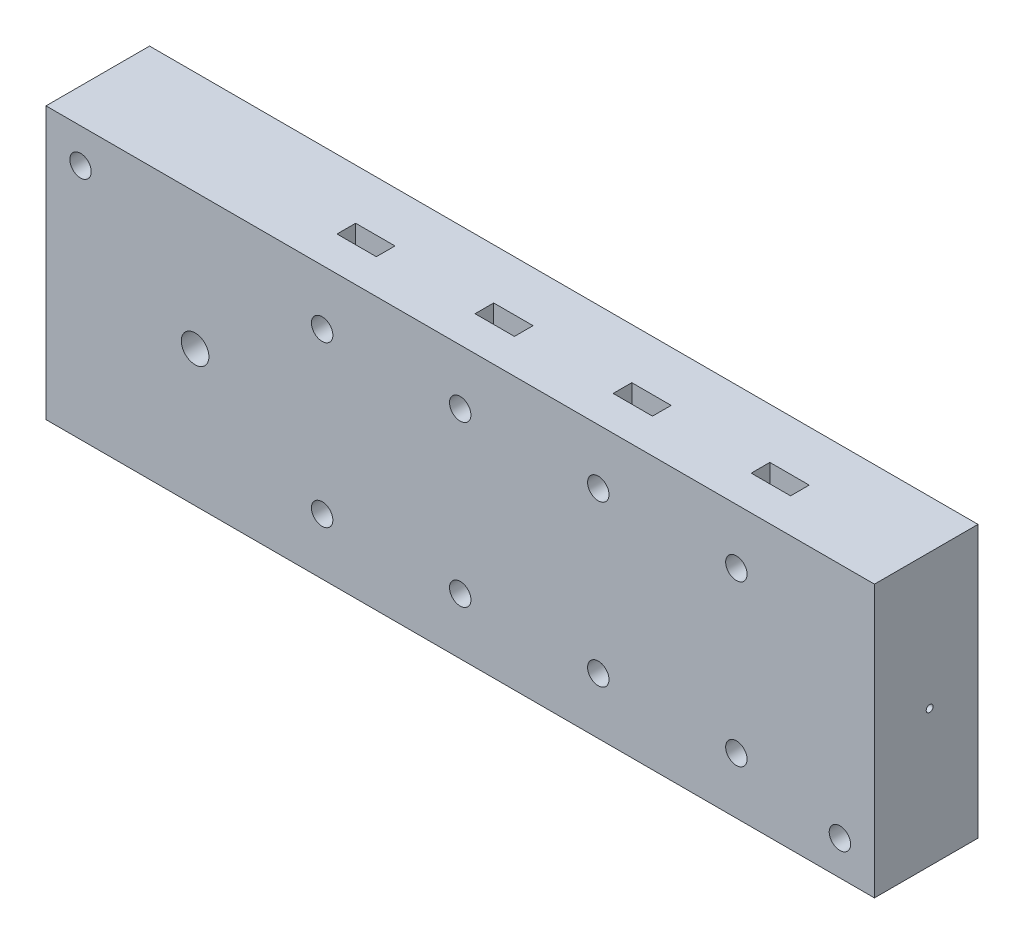
from build123d import *

# Parameters (mm, degrees)
SKIZZE2_W                        = 120
SKIZZE2_H                        = 39.364160046
AUFSATZ_LINEAR_AUSTRAGEN1_DEPTH  = 30
SKIZZE24_R                       = 1.55
SCHNITT_LINEAR_AUSTRAGEN4_DEPTH  = 130.805766806
SKIZZE46_R                       = 2.85
SCHNITT_LINEAR_AUSTRAGEN15_DEPTH = 10
SCHNITT_LINEAR_START             = -5
SCHNITT_LINEAR_AUSTRAGEN25_DEPTH = 2.7
LINEARES_MUSTER1_COUNT           = 4
LINEARES_MUSTER1_PITCH           = 20
SPIEGELN2_COPY_1_SKETCH_R        = 2.85
SPIEGELN2_COPY_1_DEPTH           = 10
SPIEGELN2_COPY_2_SKETCH_R        = 2.85
SPIEGELN2_COPY_2_DEPTH           = 10
SPIEGELN2_COPY_3_SKETCH_R        = 2.85
SPIEGELN2_COPY_3_DEPTH           = 10
SPIEGELN2_START                  = -5
SPIEGELN2_COPY_4_DEPTH           = 2.7
SPIEGELN2_COPY_5_DEPTH           = 2.7
SPIEGELN2_COPY_6_DEPTH           = 2.7
SKIZZE51_R                       = 1.55
SCHNITT_LINEAR_AUSTRAGEN26_DEPTH = 130.805766806
SKIZZE75_R                       = 0.75
SCHNITT_LINEAR_AUSTRAGEN28_DEPTH = 10
SKIZZE76_R                       = 2
SCHNITT_LINEAR_AUSTRAGEN29_DEPTH = 6
SKIZZE80_R                       = 0.5
SCHNITT_LINEAR_AUSTRAGEN34_DEPTH = 21
SCHNITT_LINEAR_START_2           = -7.5
SKIZZE81_R                       = 0.5
SCHNITT_LINEAR_AUSTRAGEN36_DEPTH = 5
ABSPALTEN3_OUTLINE_W             = 120
ABSPALTEN3_OUTLINE_H             = 39.364160046
ABSPALTEN3_OUTLINE_R             = 1.55
ABSPALTEN3_DEPTH                 = 15


# Read off the part's stored shape, not the designer's step: Abspalten3
with BuildPart() as part:
    # Skizze2 → Aufsatz-Linear austragen1 (new body)
    with BuildSketch(Plane.XY):
        with Locations((60, 19.682080023)):
            Rectangle(SKIZZE2_W, SKIZZE2_H)
    extrude(amount=AUFSATZ_LINEAR_AUSTRAGEN1_DEPTH)

    # Skizze24 → Schnitt-Linear austragen4 (cut, through all)
    with BuildSketch(Plane.XY.offset(30)):
        with Locations((40, 31.364160046)):
            Circle(SKIZZE24_R)
        with Locations((60, 31.364160046)):
            Circle(SKIZZE24_R)
        with Locations((80, 31.364160046)):
            Circle(SKIZZE24_R)
        with Locations((100, 31.364160046)):
            Circle(SKIZZE24_R)
    schnitt_linear_austragen4 = extrude(amount=-SCHNITT_LINEAR_AUSTRAGEN4_DEPTH, mode=Mode.SUBTRACT)

    # Skizze46 → Schnitt-Linear austragen15 (cut)
    with BuildSketch(Plane(origin=(0, 0, 0), x_dir=(-1, 0, 0), z_dir=(0, 0, -1))):
        with Locations((-100, 31.364160046)):
            Circle(SKIZZE46_R)
    schnitt_linear_austragen15 = extrude(amount=-SCHNITT_LINEAR_AUSTRAGEN15_DEPTH, mode=Mode.SUBTRACT)

    # Skizze50 → Schnitt-Linear austragen25 (cut)
    with BuildSketch(Plane.XY.offset(30).offset(SCHNITT_LINEAR_START)):
        Polygon((97.15, 33.009608314), (97.15, 39.364160046), (102.85, 39.364160046), (102.85, 33.009608314), (102.85, 29.718711779), (100, 28.073263512), (97.15, 29.718711779), align=None)
    schnitt_linear_austragen25 = extrude(amount=-SCHNITT_LINEAR_AUSTRAGEN25_DEPTH, mode=Mode.SUBTRACT)

    # Lineares Muster1: Schnitt-Linear austragen15, Schnitt-Linear austragen25 ×4
    with Locations(*[(-i * LINEARES_MUSTER1_PITCH, 0, 0) for i in range(1, LINEARES_MUSTER1_COUNT)]):
        add(schnitt_linear_austragen15, mode=Mode.SUBTRACT)
        add(schnitt_linear_austragen25, mode=Mode.SUBTRACT)

    # Spiegeln2: Schnitt-Linear austragen15, Schnitt-Linear austragen25 across plane
    add(schnitt_linear_austragen15.mirror(Plane.ZX.offset(19.764160046)), mode=Mode.SUBTRACT)
    add(schnitt_linear_austragen25.mirror(Plane.ZX.offset(19.764160046)), mode=Mode.SUBTRACT)

    # Spiegeln2 copy 1 sketch → Spiegeln2 copy 1 (cut)
    with BuildSketch(Plane(origin=(-20, 39.528320093, 0), x_dir=(-1, 0, 0), z_dir=(0, 0, -1))):
        with Locations((-100, -31.364160046)):
            Circle(SPIEGELN2_COPY_1_SKETCH_R)
    extrude(amount=-SPIEGELN2_COPY_1_DEPTH, mode=Mode.SUBTRACT)

    # Spiegeln2 copy 2 sketch → Spiegeln2 copy 2 (cut)
    with BuildSketch(Plane(origin=(-40, 39.528320093, 0), x_dir=(-1, 0, 0), z_dir=(0, 0, -1))):
        with Locations((-100, -31.364160046)):
            Circle(SPIEGELN2_COPY_2_SKETCH_R)
    extrude(amount=-SPIEGELN2_COPY_2_DEPTH, mode=Mode.SUBTRACT)

    # Spiegeln2 copy 3 sketch → Spiegeln2 copy 3 (cut)
    with BuildSketch(Plane(origin=(-60, 39.528320093, 0), x_dir=(-1, 0, 0), z_dir=(0, 0, -1))):
        with Locations((-100, -31.364160046)):
            Circle(SPIEGELN2_COPY_3_SKETCH_R)
    extrude(amount=-SPIEGELN2_COPY_3_DEPTH, mode=Mode.SUBTRACT)

    # Spiegeln2 copy 4 sketch → Spiegeln2 copy 4 (cut)
    with BuildSketch(Plane(origin=(-20, 39.528320093, 30), x_dir=(1, 0, 0), z_dir=(0, 0, 1)).offset(SPIEGELN2_START)):
        Polygon((97.15, -33.009608314), (97.15, -39.364160046), (102.85, -39.364160046), (102.85, -33.009608314), (102.85, -29.718711779), (100, -28.073263512), (97.15, -29.718711779), align=None)
    extrude(amount=-SPIEGELN2_COPY_4_DEPTH, mode=Mode.SUBTRACT)

    # Spiegeln2 copy 5 sketch → Spiegeln2 copy 5 (cut)
    with BuildSketch(Plane(origin=(-40, 39.528320093, 30), x_dir=(1, 0, 0), z_dir=(0, 0, 1)).offset(SPIEGELN2_START)):
        Polygon((97.15, -33.009608314), (97.15, -39.364160046), (102.85, -39.364160046), (102.85, -33.009608314), (102.85, -29.718711779), (100, -28.073263512), (97.15, -29.718711779), align=None)
    extrude(amount=-SPIEGELN2_COPY_5_DEPTH, mode=Mode.SUBTRACT)

    # Spiegeln2 copy 6 sketch → Spiegeln2 copy 6 (cut)
    with BuildSketch(Plane(origin=(-60, 39.528320093, 30), x_dir=(1, 0, 0), z_dir=(0, 0, 1)).offset(SPIEGELN2_START)):
        Polygon((97.15, -33.009608314), (97.15, -39.364160046), (102.85, -39.364160046), (102.85, -33.009608314), (102.85, -29.718711779), (100, -28.073263512), (97.15, -29.718711779), align=None)
    extrude(amount=-SPIEGELN2_COPY_6_DEPTH, mode=Mode.SUBTRACT)

    # Spiegeln3: Schnitt-Linear austragen4 across plane
    add(schnitt_linear_austragen4.mirror(Plane.ZX.offset(19.764160046)), mode=Mode.SUBTRACT)

    # Skizze51 → Schnitt-Linear austragen26 (cut, through all)
    with BuildSketch(Plane.XY.offset(30)):
        with Locations((5, 34.364160046)):
            Circle(SKIZZE51_R)
        with Locations((115, 5)):
            Circle(SKIZZE51_R)
    extrude(amount=-SCHNITT_LINEAR_AUSTRAGEN26_DEPTH, mode=Mode.SUBTRACT)

    # Skizze73 → Schnitt-Rotation5 (revolve, cut)
    with BuildSketch(Plane.XY.offset(15)):
        Polygon((15, 19.764160046), (15, 23.764160046), (20, 23.764160046), (20, 24.764160046), (100, 23.182080023), (100, 22.182080023), (105, 22.182080023), (105, 19.682080023), align=None)
    revolve(axis=Axis((105, 19.682080023, 15), (-0.9999995841280241, 0.0009119998787298228, 0)), mode=Mode.SUBTRACT)

    # Skizze75 → Schnitt-Linear austragen28 (cut)
    with BuildSketch(Plane.XY.offset(30)):
        with Locations((21.598259807, 19.682080023)):
            Circle(SKIZZE75_R)
    extrude(amount=-SCHNITT_LINEAR_AUSTRAGEN28_DEPTH, mode=Mode.SUBTRACT)

    # Skizze76 → Schnitt-Linear austragen29 (cut)
    with BuildSketch(Plane.XY.offset(30)):
        with Locations((21.598259807, 19.682080023)):
            Circle(SKIZZE76_R)
    extrude(amount=-SCHNITT_LINEAR_AUSTRAGEN29_DEPTH, mode=Mode.SUBTRACT)

    # Skizze80 → Schnitt-Linear austragen34 (cut)
    with BuildSketch(Plane(origin=(120, 0, 0), x_dir=(0, 0, -1), z_dir=(1, 0, 0))):
        with Locations((-22.000416524, 19.763714623)):
            Circle(SKIZZE80_R)
    schnitt_linear_austragen34 = extrude(amount=-SCHNITT_LINEAR_AUSTRAGEN34_DEPTH, mode=Mode.SUBTRACT)

    # Skizze81 → Schnitt-Linear austragen36 (cut)
    with BuildSketch(Plane.XY.offset(30).offset(SCHNITT_LINEAR_START_2)):
        with Locations(Location((99, 19.682080023, 0), (0, 0, 7.034090001))):
            Circle(SKIZZE81_R)
    schnitt_linear_austragen36 = extrude(amount=-SCHNITT_LINEAR_AUSTRAGEN36_DEPTH, mode=Mode.SUBTRACT)

    # Spiegeln4: Schnitt-Linear austragen34, Schnitt-Linear austragen36 across plane
    add(schnitt_linear_austragen34.mirror(Plane.XY.offset(15)), mode=Mode.SUBTRACT)
    add(schnitt_linear_austragen36.mirror(Plane.XY.offset(15)), mode=Mode.SUBTRACT)

    # Abspalten3 outline → Abspalten3 (cut)
    with BuildSketch(Plane.XY):
        with Locations((60, 19.682080023)):
            Rectangle(ABSPALTEN3_OUTLINE_W, ABSPALTEN3_OUTLINE_H)
        with Locations((115, 5)):
            Circle(ABSPALTEN3_OUTLINE_R, mode=Mode.SUBTRACT)
        with Locations((5, 34.364160046)):
            Circle(ABSPALTEN3_OUTLINE_R, mode=Mode.SUBTRACT)
        with Locations((40, 8.164160046)):
            Circle(ABSPALTEN3_OUTLINE_R, mode=Mode.SUBTRACT)
        with Locations((60, 8.164160046)):
            Circle(ABSPALTEN3_OUTLINE_R, mode=Mode.SUBTRACT)
        with Locations((80, 8.164160046)):
            Circle(ABSPALTEN3_OUTLINE_R, mode=Mode.SUBTRACT)
        with Locations((100, 8.164160046)):
            Circle(ABSPALTEN3_OUTLINE_R, mode=Mode.SUBTRACT)
        with Locations((40, 31.364160046)):
            Circle(ABSPALTEN3_OUTLINE_R, mode=Mode.SUBTRACT)
        with Locations((100, 31.364160046)):
            Circle(ABSPALTEN3_OUTLINE_R, mode=Mode.SUBTRACT)
        with Locations((60, 31.364160046)):
            Circle(ABSPALTEN3_OUTLINE_R, mode=Mode.SUBTRACT)
        with Locations((80, 31.364160046)):
            Circle(ABSPALTEN3_OUTLINE_R, mode=Mode.SUBTRACT)
    extrude(amount=ABSPALTEN3_DEPTH, mode=Mode.SUBTRACT)


solid = part.part
